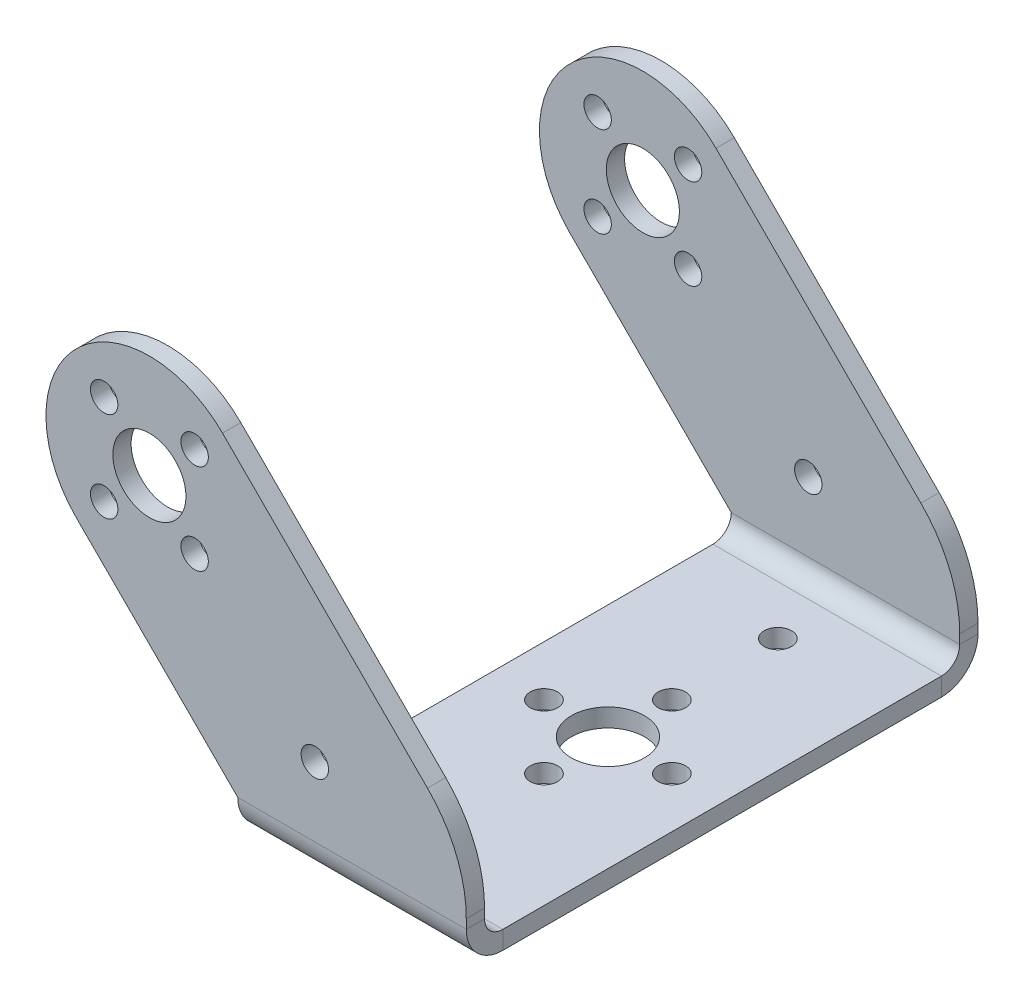
from build123d import *

# Parameters (mm, degrees)
BASE_FLANGE1_DEPTH    = 2
EDGE_FLANGE1_DEPTH    = 25
SKETCH19_R            = 4
CUT_EXTRUDE2_DEPTH    = 58.225619191
M3X0_5_TAPPED_HOLE1_D = 3
SKETCH22_R            = 4
CUT_EXTRUDE3_DEPTH    = 77.018231312
M3X0_5_TAPPED_HOLE2_D = 3


# Sheet-metal steps are written as plain solids
with BuildPart() as part:
    # Sketch8 → Base-Flange1 (new body)
    with BuildSketch(Plane.XY):
        with BuildLine():
            Line((-12.5, 0), (12.5, 0))
            Line((12.5, 0), (12.5, 1.008188695))
            ThreePointArc((12.5, 1.008188695), (11.396253221, 6.557098465), (8.253048327, 11.261237023))
            Line((8.253048327, 11.261237023), (-14.170526855, 33.684812205))
            ThreePointArc((-14.170526855, 33.684812205), (-30.17766953, 33.684812205), (-30.17766953, 17.67766953))
            Line((-30.17766953, 17.67766953), (-12.5, 0))
        make_face()
    extrude(amount=-BASE_FLANGE1_DEPTH)

    # Edge-Flange1 section (across the edge) → Edge-Flange1 (add)
    with BuildSketch(Plane(origin=(12.5, -2, -2), x_dir=(0, 1, 0), z_dir=(-1, 0, 0))):
        with BuildLine():
            Line((-2, 2), (-2, 26))
            Line((-2, 26), (0, 26))
            Line((0, 26), (0, 2))
            ThreePointArc((0, 2), (0.585786438, 0.585786438), (2, 0))
            Line((2, 0), (2, -2))
            ThreePointArc((2, -2), (-0.828427125, -0.828427125), (-2, 2))
        make_face()
    extrude(amount=EDGE_FLANGE1_DEPTH)

    # Sketch19 → Cut-Extrude2 (cut, through all)
    with BuildSketch(Plane.XY):
        with Locations((-22.174098192, 25.681240867)):
            Circle(SKETCH19_R)
    extrude(amount=-CUT_EXTRUDE2_DEPTH, mode=Mode.SUBTRACT)

    # M3x0.5 Tapped Hole1 (through all)
    with Locations(Plane.XY):
        with Locations((-27.123845661, 30.630988335), (-27.123845661, 20.731493399), (-17.224350724, 20.731493399), (-17.224350724, 30.630988335), (-4.072164594, 7.579307269)):
            Hole(M3X0_5_TAPPED_HOLE1_D / 2)

    # Mirror1: part across plane


with BuildPart() as part_1:
    add(part.part)
    add(part.part.mirror(Plane(origin=(12.5, -4, -28), x_dir=(1, 0, 0), z_dir=(0, 0, 1))))

    # Sketch22 → Cut-Extrude3 (cut, through all)
    with BuildSketch(Plane(origin=(0, -2, 0), x_dir=(1, 0, 0), z_dir=(0, 1, 0))):
        with Locations(Location((0, 28, 0), (0, 0, 270))):
            Circle(SKETCH22_R)
    extrude(amount=-CUT_EXTRUDE3_DEPTH, mode=Mode.SUBTRACT)

    # M3x0.5 Tapped Hole2 (through all)
    with Locations(Plane(origin=(0, -2, 0), x_dir=(1, 0, 0), z_dir=(0, 1, 0))):
        with Locations((7, 28), (-7, 28), (0, 35), (0, 21), (0, 9.4), (0, 46.6)):
            Hole(M3X0_5_TAPPED_HOLE2_D / 2)


solid = part_1.part
